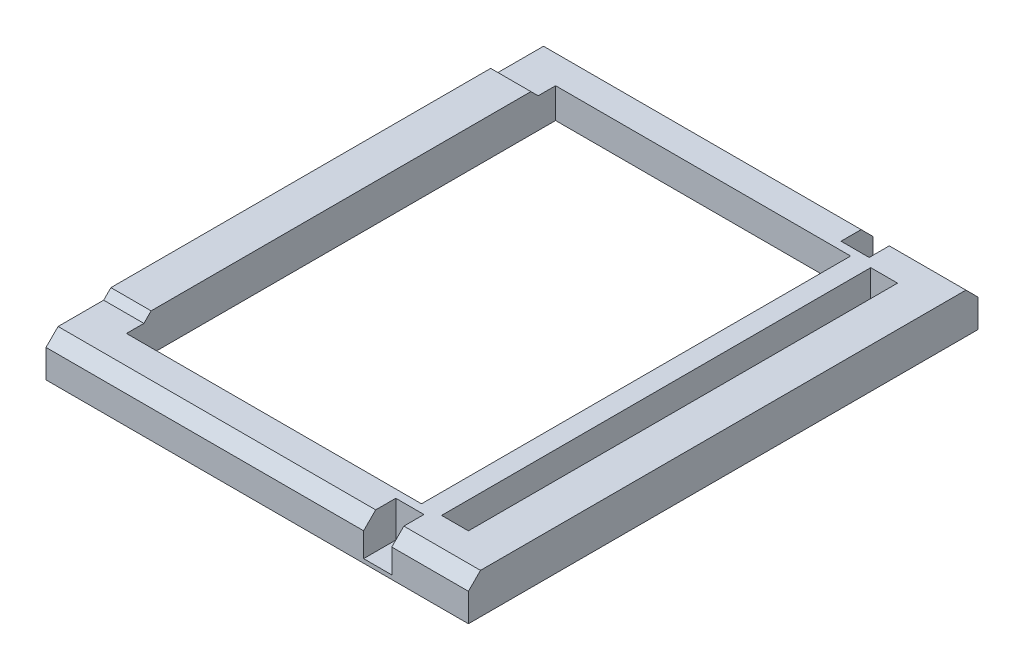
from build123d import *

# Parameters (mm, degrees)
SKETCH2_W           = 133.35
SKETCH2_H           = 160.866666666
SKETCH2_W_2         = 93.133333333
SKETCH2_H_2         = 135.466666666
SKETCH2_W_3         = 8.466666667
BOSS_EXTRUDE1_DEPTH = 12.7
CUT_EXTRUDE1_DEPTH  = 6.35
CHAMFER4_SIZE       = 3.81
CHAMFER1_SIZE       = 0.635
CHAMFER2_SIZE       = 3.175
SKETCH4_W           = 8.89
SKETCH4_H           = 11.43
CUT_EXTRUDE2_DEPTH  = 10.16
SKETCH5_W           = 8.89
SKETCH5_H           = 11.43
CUT_EXTRUDE3_DEPTH  = 10.16
SKETCH6_W           = 12.7
SKETCH6_H           = 124.46
BOSS_EXTRUDE2_DEPTH = 2.286
CHAMFER5_SIZE       = 2.286


with BuildPart() as part:
    # Sketch2 → Boss-Extrude1 (new body)
    with BuildSketch(Plane(origin=(0, 0, 0), x_dir=(1, 0, 0), z_dir=(0, 1, 0))):
        Rectangle(SKETCH2_W, SKETCH2_H)
        with Locations((-7.408333333, 0)):
            Rectangle(SKETCH2_W_2, SKETCH2_H_2, mode=Mode.SUBTRACT)
        with Locations((49.741666667, 0)):
            Rectangle(SKETCH2_W_3, SKETCH2_H_2, mode=Mode.SUBTRACT)
    extrude(amount=BOSS_EXTRUDE1_DEPTH)

    # Sketch3 → Cut-Extrude1 (cut)
    with BuildSketch(Plane.XZ):
        Polygon((-57.15, 76.2), (-60.325, 73.025), (-63.5, 76.2), (-60.325, 79.375), align=None)
        Polygon((57.15, 76.2), (53.975, 73.025), (50.8, 76.2), (53.975, 79.375), align=None)
        Polygon((63.5, -76.2), (60.325, -79.375), (57.15, -76.2), (60.325, -73.025), align=None)
        Polygon((-57.15, -76.2), (-60.325, -79.375), (-63.5, -76.2), (-60.325, -73.025), align=None)
    extrude(amount=-CUT_EXTRUDE1_DEPTH, mode=Mode.SUBTRACT)

    # Chamfer4
    chamfer4_edges = [part.edges().sort_by_distance(p)[0] for p in [
        (0, 12.7, -80.433333333),
        (0, 12.7, 80.433333333),
    ]]
    chamfer(chamfer4_edges, length=CHAMFER4_SIZE)

    # Chamfer1
    chamfer1_edges = [part.edges().sort_by_distance(p)[0] for p in [
        (-58.7375, 6.35, -74.6125),
        (-58.7375, 6.35, -77.7875),
        (-61.9125, 6.35, -77.7875),
        (-61.9125, 6.35, -74.6125),
        (-58.7375, 0, -74.6125),
        (-61.9125, 0, -74.6125),
        (-61.9125, 0, -77.7875),
        (-58.7375, 0, -77.7875),
        (61.9125, 6.35, -74.6125),
        (61.9125, 6.35, -77.7875),
        (58.7375, 6.35, -77.7875),
        (58.7375, 6.35, -74.6125),
        (61.9125, 0, -74.6125),
        (58.7375, 0, -74.6125),
        (58.7375, 0, -77.7875),
        (61.9125, 0, -77.7875),
        (55.5625, 6.35, 77.7875),
        (55.5625, 6.35, 74.6125),
        (52.3875, 6.35, 74.6125),
        (52.3875, 6.35, 77.7875),
        (55.5625, 0, 77.7875),
        (52.3875, 0, 77.7875),
        (52.3875, 0, 74.6125),
        (55.5625, 0, 74.6125),
        (-58.7375, 6.35, 77.7875),
        (-58.7375, 6.35, 74.6125),
        (-61.9125, 6.35, 74.6125),
        (-61.9125, 6.35, 77.7875),
        (-58.7375, 0, 77.7875),
        (-61.9125, 0, 77.7875),
        (-61.9125, 0, 74.6125),
        (-58.7375, 0, 74.6125),
    ]]
    chamfer(chamfer1_edges, length=CHAMFER1_SIZE)

    # Chamfer2
    chamfer2_edges = [part.edges().sort_by_distance(p)[0] for p in [
        (53.975, 0, 0),
        (49.741666667, 0, -67.733333333),
        (49.741666667, 0, 67.733333333),
        (-7.408333333, 0, -67.733333333),
        (-53.975, 0, 0),
        (-7.408333333, 0, 67.733333333),
    ]]
    chamfer(chamfer2_edges, length=CHAMFER2_SIZE)

    # Sketch4 → Cut-Extrude2 (cut)
    with BuildSketch(Plane.XY.offset(80.433333333)):
        with Locations((38.0365, 6.985)):
            Rectangle(SKETCH4_W, SKETCH4_H)
    extrude(amount=-CUT_EXTRUDE2_DEPTH, mode=Mode.SUBTRACT)

    # Sketch5 → Cut-Extrude3 (cut)
    with BuildSketch(Plane(origin=(0, 0, -80.433333333), x_dir=(-1, 0, 0), z_dir=(0, 0, -1))):
        with Locations((-38.0365, 6.985)):
            Rectangle(SKETCH5_W, SKETCH5_H)
    extrude(amount=-CUT_EXTRUDE3_DEPTH, mode=Mode.SUBTRACT)

    # Sketch6 → Boss-Extrude2 (add)
    with BuildSketch(Plane(origin=(0, 12.7, 0), x_dir=(1, 0, 0), z_dir=(0, 1, 0))):
        with Locations((-60.325, 0)):
            Rectangle(SKETCH6_W, SKETCH6_H)
    extrude(amount=BOSS_EXTRUDE2_DEPTH)

    # Chamfer5
    chamfer5_edges = [part.edges().sort_by_distance(p)[0] for p in [
        (-60.325, 14.986, -62.23),
        (-60.325, 14.986, 62.23),
    ]]
    chamfer(chamfer5_edges, length=CHAMFER5_SIZE - 0.0001)  # a hair under: the kernel refuses the full size


solid = part.part
